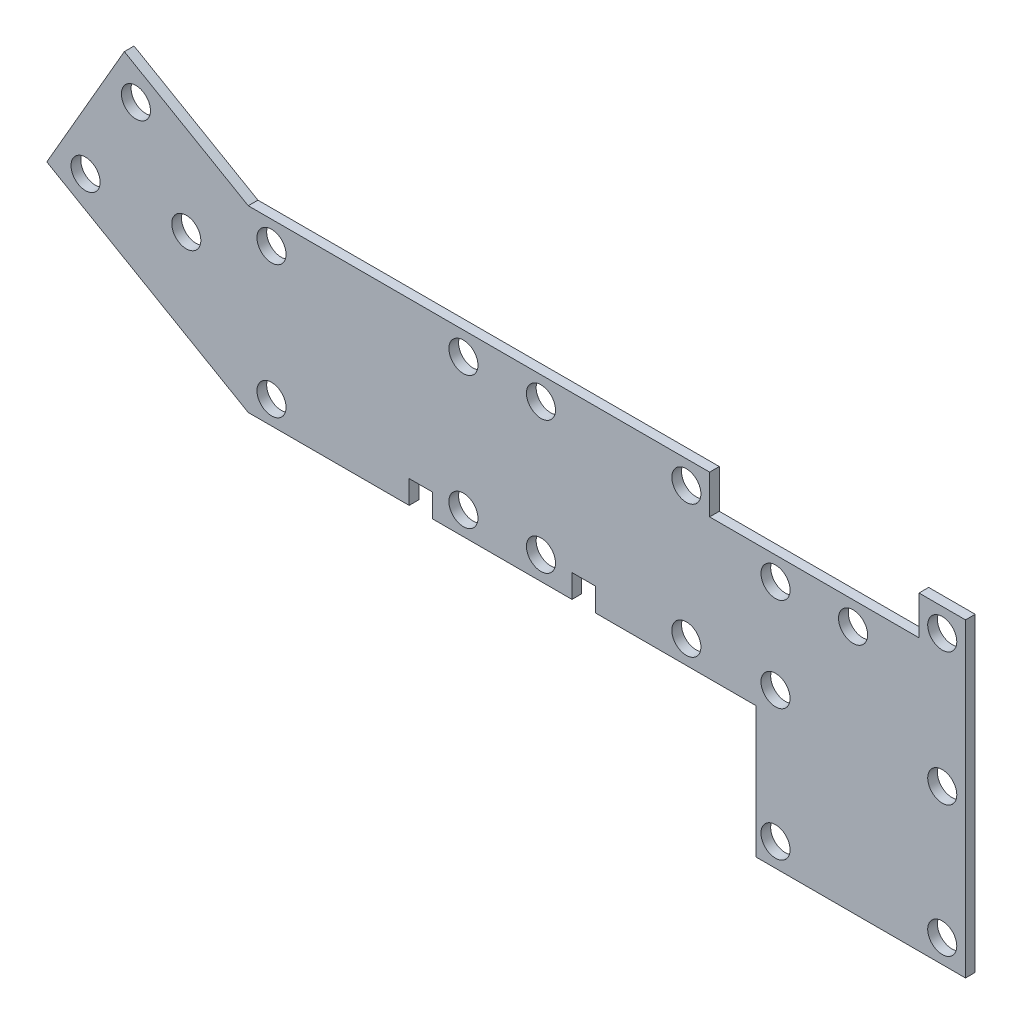
from build123d import *

# Parameters (mm, degrees)
SKETCH1_R           = 4.7625
BOSS_EXTRUDE1_DEPTH = 3.175


with BuildPart() as part:
    # Sketch1 → Boss-Extrude1 (new body)
    with BuildSketch(Plane.XY):
        Polygon((113.03, 0), (0, 0), (-40.591135768, 23.435303163), (-65.991135768, -20.55878735), (0, -58.65878735), (52.705, -58.65878735), (52.705, -51.03878735), (60.325, -51.03878735), (60.325, -58.65878735), (106.045, -58.65878735), (106.045, -51.03878735), (113.665, -51.03878735), (113.665, -58.65878735), (166.37, -58.65878735), (166.37, -101.6), (234.95, -101.6), (234.95, 0), (219.71, 0), (219.71, -12.7), (151.13, -12.7), (151.13, 0), align=None)
        with Locations((7.62, -51.03878735)):
            Circle(SKETCH1_R, mode=Mode.SUBTRACT)
        with Locations((70.485, -51.03878735)):
            Circle(SKETCH1_R, mode=Mode.SUBTRACT)
        with Locations((172.72, -93.98)):
            Circle(SKETCH1_R, mode=Mode.SUBTRACT)
        with Locations((227.33, -93.98)):
            Circle(SKETCH1_R, mode=Mode.SUBTRACT)
        with Locations((95.885, -51.03878735)):
            Circle(SKETCH1_R, mode=Mode.SUBTRACT)
        with Locations((143.51, -51.03878735)):
            Circle(SKETCH1_R, mode=Mode.SUBTRACT)
        with Locations((172.72, -51.03878735)):
            Circle(SKETCH1_R, mode=Mode.SUBTRACT)
        with Locations((227.33, -51.03878735)):
            Circle(SKETCH1_R, mode=Mode.SUBTRACT)
        with Locations((-53.291135768, -17.611742094)):
            Circle(SKETCH1_R, mode=Mode.SUBTRACT)
        with Locations((-20.295567884, -17.611742094)):
            Circle(SKETCH1_R, mode=Mode.SUBTRACT)
        with Locations((7.62, -7.62)):
            Circle(SKETCH1_R, mode=Mode.SUBTRACT)
        with Locations((-36.793351826, 10.963257906)):
            Circle(SKETCH1_R, mode=Mode.SUBTRACT)
        with Locations((70.485, -7.62)):
            Circle(SKETCH1_R, mode=Mode.SUBTRACT)
        with Locations((172.72, -20.32)):
            Circle(SKETCH1_R, mode=Mode.SUBTRACT)
        with Locations((198.12, -20.32)):
            Circle(SKETCH1_R, mode=Mode.SUBTRACT)
        with Locations((95.885, -7.62)):
            Circle(SKETCH1_R, mode=Mode.SUBTRACT)
        with Locations((143.51, -7.62)):
            Circle(SKETCH1_R, mode=Mode.SUBTRACT)
        with Locations((227.33, -7.62)):
            Circle(SKETCH1_R, mode=Mode.SUBTRACT)
    extrude(amount=BOSS_EXTRUDE1_DEPTH)


solid = part.part
